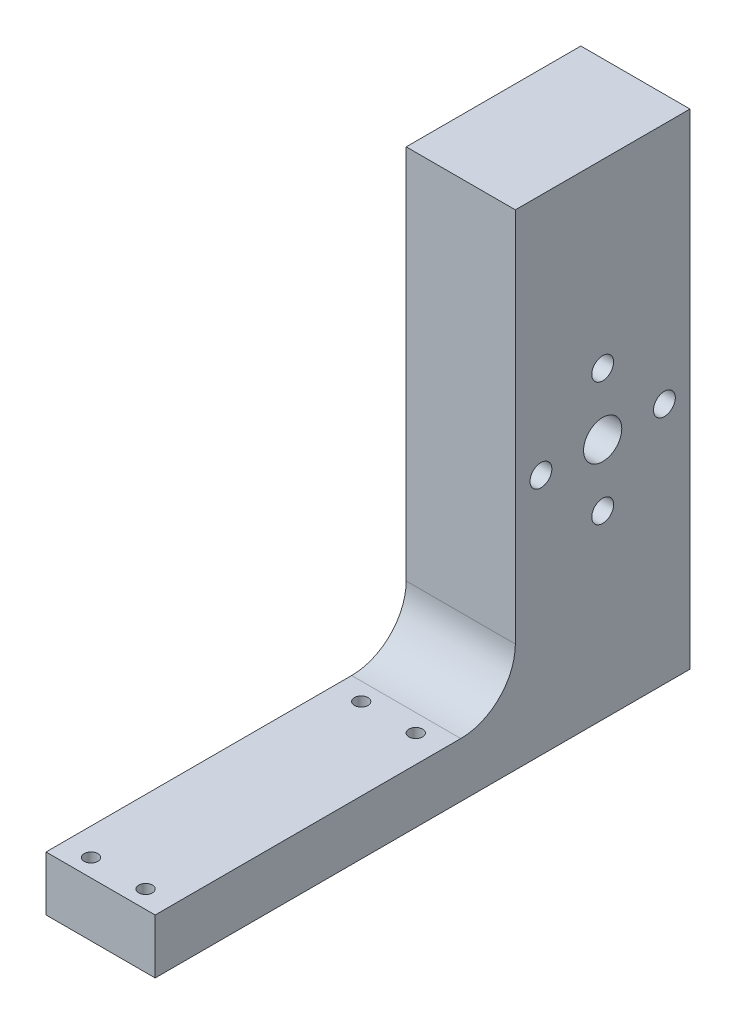
from build123d import *

# Parameters (mm, degrees)
SKETCH1_W           = 20
SKETCH1_H           = 66
SKETCH1_R           = 1.25
BOSS_EXTRUDE1_DEPTH = 10
SKETCH2_W           = 20
SKETCH2_H           = 88.9
BOSS_EXTRUDE2_DEPTH = 32
FILLET1_R           = 10
SKETCH3_R           = 2
SKETCH3_R_2         = 3.5
CUT_EXTRUDE1_DEPTH  = 32


with BuildPart() as part:
    # Sketch1 → Boss-Extrude1 (new body)
    with BuildSketch(Plane(origin=(0, 0, 0), x_dir=(1, 0, 0), z_dir=(0, 1, 0))):
        with Locations((10, 27)):
            Rectangle(SKETCH1_W, SKETCH1_H)
        with Locations((5, 46.75)):
            Circle(SKETCH1_R, mode=Mode.SUBTRACT)
        with Locations((15, 46.75)):
            Circle(SKETCH1_R, mode=Mode.SUBTRACT)
        with Locations((5, -2.75)):
            Circle(SKETCH1_R, mode=Mode.SUBTRACT)
        with Locations((15, -2.75)):
            Circle(SKETCH1_R, mode=Mode.SUBTRACT)
    extrude(amount=BOSS_EXTRUDE1_DEPTH)

    # Sketch2 → Boss-Extrude2 (add)
    with BuildSketch(Plane(origin=(0, 0, -60), x_dir=(-1, 0, 0), z_dir=(0, 0, -1))):
        with Locations((-10, 44.45)):
            Rectangle(SKETCH2_W, SKETCH2_H)
    extrude(amount=BOSS_EXTRUDE2_DEPTH)

    # Fillet1
    fillet1_edges = [part.edges().sort_by_distance(p)[0] for p in [
        (10, 10, -60),
    ]]
    fillet(fillet1_edges, radius=FILLET1_R)

    # Sketch3 → Cut-Extrude1 (cut)
    with BuildSketch(Plane(origin=(20, 0, 0), x_dir=(0, 0, -1), z_dir=(1, 0, 0))):
        with Locations((76, 55.763708499)):
            Circle(SKETCH3_R)
        with Locations((64.686291501, 44.45)):
            Circle(SKETCH3_R)
        with Locations((76, 44.45)):
            Circle(SKETCH3_R_2)
        with Locations((87.313708499, 44.45)):
            Circle(SKETCH3_R)
        with Locations((76, 33.136291501)):
            Circle(SKETCH3_R)
    extrude(amount=-CUT_EXTRUDE1_DEPTH, mode=Mode.SUBTRACT)


solid = part.part
